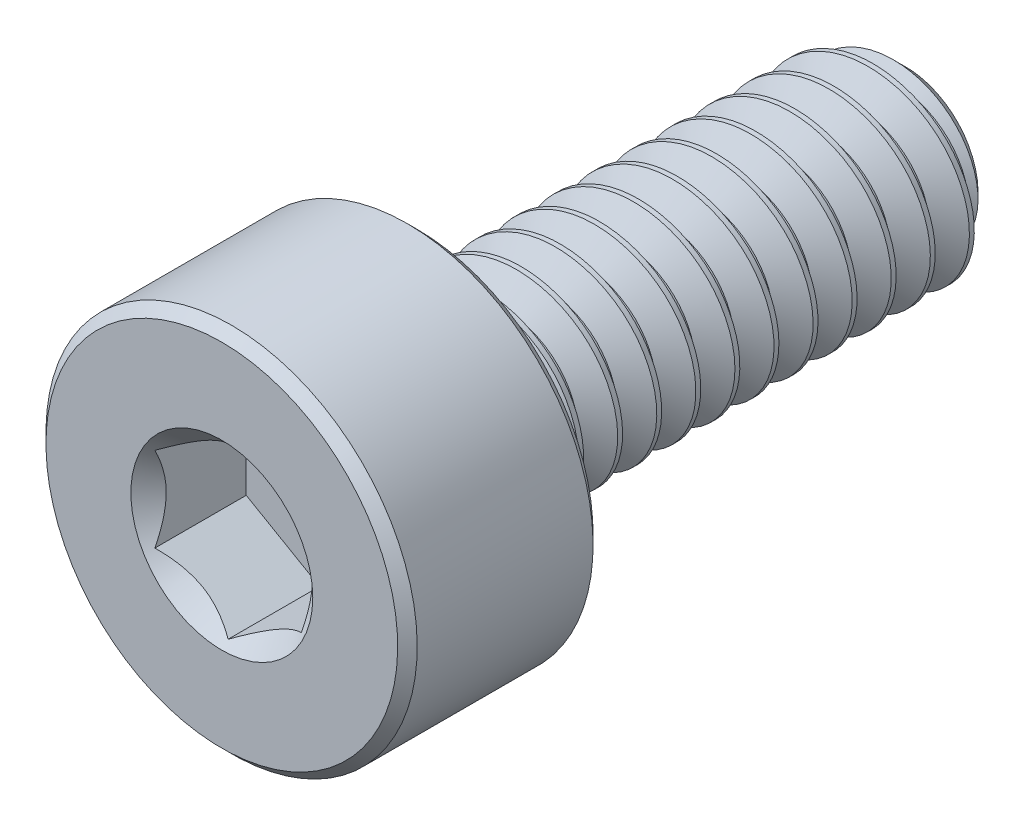
from build123d import *

# Parameters (mm, degrees)
CUT_EXTRUDE1_DEPTH     = 1
SPLIT1_SURFACE_1_BACK  = 9.825
SPLIT1_SURFACE_1_DEPTH = 19.65
SPLIT1_SURFACE_2_BACK  = 9.825
SPLIT1_SURFACE_2_DEPTH = 19.65
CUT_SWEEP1_PITCH       = 0.4


with BuildPart() as part:
    # Sketch2 → Revolve1 (revolve)
    with BuildSketch(Plane(origin=(0, 0, 0), x_dir=(0, 0, -1), z_dir=(1, 0, 0))):
        with BuildLine():
            Line((-3.5, 0), (-3.5, 1.8))
            Line((-3.5, 1.8), (-3.4, 1.9))
            Line((-3.4, 1.9), (-1.6, 1.9))
            Line((-1.6, 1.9), (-1.5, 1.8))
            Line((-1.5, 1.8), (-1.5, 1.1))
            ThreePointArc((-1.5, 1.1), (-1.470710678, 1.029289322), (-1.4, 1))
            Line((-1.4, 1), (3.240192379, 1))
            Line((3.240192379, 1), (3.5, 0.740192379))
            Line((3.5, 0.740192379), (3.5, 0))
            Line((3.5, 0), (-3.5, 0))
        make_face()
    revolve(axis=Axis((0, 0, -3.5), (0, 0, 1)))

    # Sketch3 → Cut-Extrude1 (cut)
    with BuildSketch(Plane.XY.offset(3.5)):
        Polygon((0.75, -0.433012702), (0.75, 0.433012702), (0, 0.866025404), (-0.75, 0.433012702), (-0.75, -0.433012702), (0, -0.866025404), align=None)
    extrude(amount=-CUT_EXTRUDE1_DEPTH, mode=Mode.SUBTRACT)

    # Cut-Extrude2 cone 1 section (through the dimple's axis) → Cut-Extrude2 (revolve, cut)
    with BuildSketch(Plane(origin=(0, 0, 3.5), x_dir=(0, -1, 0), z_dir=(1, 0, 0))):
        Polygon((0, 0), (0.930977309, 0), (0, 0.930977309), align=None)
    revolve(axis=Axis((0, 0, 3.5), (0, 0, -1)), mode=Mode.SUBTRACT)


with BuildPart() as body_2:
    # Split1: the piece behind the surface
    add(part.part)
    # Split1 surface: a surface, the sketch's curves swept straight by 19.65 mm
    with BuildLine(Plane(origin=(0, 0, 0), x_dir=(0, 0, -1), z_dir=(1, 0, 0)).offset(-SPLIT1_SURFACE_1_BACK), mode=Mode.PRIVATE) as split1_surface_1_path:
        Line((-1.4, -1.9), (-1.4, 1.9))
    split1_surface_1 = Shell.extrude(split1_surface_1_path.wire(), (1 * SPLIT1_SURFACE_1_DEPTH, 0 * SPLIT1_SURFACE_1_DEPTH, 0 * SPLIT1_SURFACE_1_DEPTH))
    split(bisect_by=split1_surface_1, keep=Keep.BOTTOM)

    # Cut-Sweep1: the profile of Sketch7 screwed along a right-hand helix of 13.5 turns, 6 arcs to a turn; built about Z, then put on its axis
    cut_sweep1_z = Axis((0, 0, 0), (0, 0, 1))
    cut_sweep1_corners = [(1.021650635, 0, 0.0125), (1.021650635, 0, -0.3625), (0.740192379, 0, -0.2), (0.740192379, 0, -0.15)]
    with BuildLine(mode=Mode.PRIVATE) as cut_sweep1_profile:
        Line(cut_sweep1_corners[0], cut_sweep1_corners[1])
        Line(cut_sweep1_corners[1], cut_sweep1_corners[2])
        Line(cut_sweep1_corners[2], cut_sweep1_corners[3])
        Line(cut_sweep1_corners[3], cut_sweep1_corners[0])
    cut_sweep1_cap = Face(cut_sweep1_profile.wire())
    cut_sweep1_turn_angles = [0, 30, 60, 90, 120, 150, 180, 210, 240, 270, 300, 330, 360]
    cut_sweep1_turn_weights = [1, 0.8660254037844387, 1, 0.8660254037844387, 1, 0.8660254037844387, 1, 0.8660254037844387, 1, 0.8660254037844387, 1, 0.8660254037844387, 1]
    cut_sweep1_turn_rails = [Edge.make_bspline([Vector(p[0], p[1], 0).rotate(cut_sweep1_z, cut_sweep1_turn_angles[k]) / cut_sweep1_turn_weights[k] + Vector(0, 0, p[2] + CUT_SWEEP1_PITCH * cut_sweep1_turn_angles[k] / 360) for k in range(13)], [0, 0, 0, 1, 1, 2, 2, 3, 3, 4, 4, 5, 5, 6, 6, 6], 2, cut_sweep1_turn_weights) for p in cut_sweep1_corners]
    cut_sweep1_turn_sides = [Face.make_surface_from_curves(cut_sweep1_turn_rails[p[0]], cut_sweep1_turn_rails[p[1]]) for p in [(0, 1), (1, 2), (2, 3), (3, 0)]]
    cut_sweep1_turn = Solid(Shell([*cut_sweep1_turn_sides, cut_sweep1_cap, cut_sweep1_cap.rotate(cut_sweep1_z, 360).moved(Location((0, 0, CUT_SWEEP1_PITCH * 360 / 360)))]))
    cut_sweep1_last_angles = [4680, 4710, 4740, 4770, 4800, 4830, 4860]
    cut_sweep1_last_weights = [1, 0.8660254037844387, 1, 0.8660254037844387, 1, 0.8660254037844625, 1]
    cut_sweep1_last_rails = [Edge.make_bspline([Vector(p[0], p[1], 0).rotate(cut_sweep1_z, cut_sweep1_last_angles[k]) / cut_sweep1_last_weights[k] + Vector(0, 0, p[2] + CUT_SWEEP1_PITCH * cut_sweep1_last_angles[k] / 360) for k in range(7)], [0, 0, 0, 1, 1, 2, 2, 3, 3, 3], 2, cut_sweep1_last_weights) for p in cut_sweep1_corners]
    cut_sweep1_last_sides = [Face.make_surface_from_curves(cut_sweep1_last_rails[p[0]], cut_sweep1_last_rails[p[1]]) for p in [(0, 1), (1, 2), (2, 3), (3, 0)]]
    cut_sweep1_last = Solid(Shell([*cut_sweep1_last_sides, cut_sweep1_cap.rotate(cut_sweep1_z, 4680).moved(Location((0, 0, CUT_SWEEP1_PITCH * 4680 / 360))), cut_sweep1_cap.rotate(cut_sweep1_z, 4860).moved(Location((0, 0, CUT_SWEEP1_PITCH * 4860 / 360)))]))
    cut_sweep1_each = [*[cut_sweep1_turn.moved(Location((0, 0, CUT_SWEEP1_PITCH * i))) for i in range(13)], cut_sweep1_last]
    add(Plane(origin=(0, 0, -3.5), x_dir=(0, 1, 0), z_dir=(0, 0, 1)) * Compound([cut_sweep1_each[i] for i in range(0, 14, 2)]), mode=Mode.SUBTRACT)
    add(Plane(origin=(0, 0, -3.5), x_dir=(0, 1, 0), z_dir=(0, 0, 1)) * Compound([cut_sweep1_each[i] for i in range(1, 14, 2)]), mode=Mode.SUBTRACT)


with BuildPart() as part_1:
    add(part.part)

    # Split1: split by a surface, the side it looks to stays
    # Split1 surface: a surface, the sketch's curves swept straight by 19.65 mm
    with BuildLine(Plane(origin=(0, 0, 0), x_dir=(0, 0, -1), z_dir=(1, 0, 0)).offset(-SPLIT1_SURFACE_2_BACK), mode=Mode.PRIVATE) as split1_surface_2_path:
        Line((-1.4, -1.9), (-1.4, 1.9))
    split1_surface_2 = Shell.extrude(split1_surface_2_path.wire(), (1 * SPLIT1_SURFACE_2_DEPTH, 0 * SPLIT1_SURFACE_2_DEPTH, 0 * SPLIT1_SURFACE_2_DEPTH))
    split(bisect_by=split1_surface_2, keep=Keep.TOP)

    add(body_2.part)  # Revolve2 merges body 2
    # Sketch8 → Revolve2 (revolve)
    with BuildSketch(Plane(origin=(0, 0, 0), x_dir=(0, 0, -1), z_dir=(1, 0, 0)), mode=Mode.PRIVATE) as revolve2_sk:
        Polygon((-1.5, 0), (-1.5, 1), (-1.4, 1), (-0.822649731, 0), align=None)
    revolve(revolve2_sk.sketch.rotate(Axis((0, 0, 0.822649731), (0, 0, 1)), 270), axis=Axis((0, 0, 0.822649731), (0, 0, 1)))


solid = part_1.part
